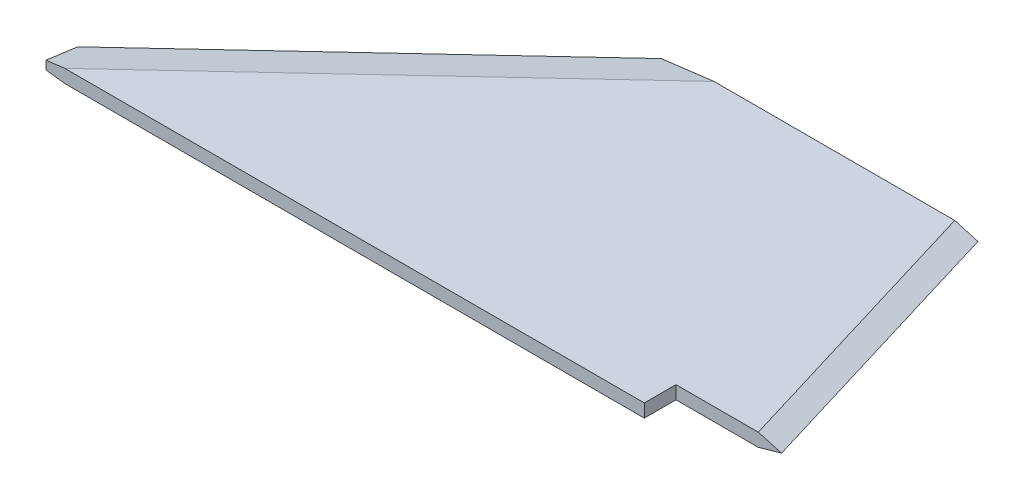
from build123d import *

# Parameters (mm, degrees)
SKETCH2_W               = 215.9
SKETCH2_H               = 11.43
BOSS_EXTRUDE1_DEPTH     = 4.7498
CUT_EXTRUDE1_DEPTH      = 127
CUT_EXTRUDE2_DEPTH      = 184.94568422
CUT_EXTRUDE2_DEPTH_BACK = 184.94568422


with BuildPart() as part:
    # Sketch2 → Boss-Extrude1 (new body)
    with BuildSketch(Plane(origin=(0, 0, 0), x_dir=(1, 0, 0), z_dir=(0, 1, 0))):
        Polygon((108.966, 101.612438876), (0, 0), (215.9, 0), (254, 0), (223.266, 101.612438876), align=None)
        with Locations((107.95, -5.715)):
            Rectangle(SKETCH2_W, SKETCH2_H)
    extrude(amount=BOSS_EXTRUDE1_DEPTH)

    # Sketch11 → Cut-Extrude1 (cut)
    with BuildSketch(Plane(origin=(21.289272777, 0, 70.386377589), x_dir=(-0.9571749920693967, 0, 0.2895099904268422), z_dir=(-0.2895099904268422, 0, -0.9571749920693967))):
        Polygon((-243.122447986, 2.3749), (-235.083929839, 4.7498), (-235.083929839, 6.735693681), (-246.008613283, 6.735693681), (-246.008613283, -1.683735196), (-235.083929839, -1.683735196), (-235.083929839, 0), align=None)
    extrude(amount=CUT_EXTRUDE1_DEPTH, mode=Mode.SUBTRACT)

    # Sketch9 → Cut-Extrude2 (cut, two sides: drawn at the far end of the back side and taken through both)
    with BuildSketch(Plane(origin=(108.966, 0, -101.612438876), x_dir=(0.6819983600624973, 0, 0.7313537016191718), z_dir=(-0.7313537016191718, 0, 0.6819983600624973)).offset(-CUT_EXTRUDE2_DEPTH_BACK)):
        Polygon((0, 2.3749), (12.992733122, 0), (12.992733122, -1.975315997), (-2.377492565, -1.975315997), (-2.377492565, 7.448660166), (12.992733122, 7.448660166), (12.992733122, 4.7498), align=None)
    extrude(amount=CUT_EXTRUDE2_DEPTH + CUT_EXTRUDE2_DEPTH_BACK, mode=Mode.SUBTRACT)


solid = part.part
